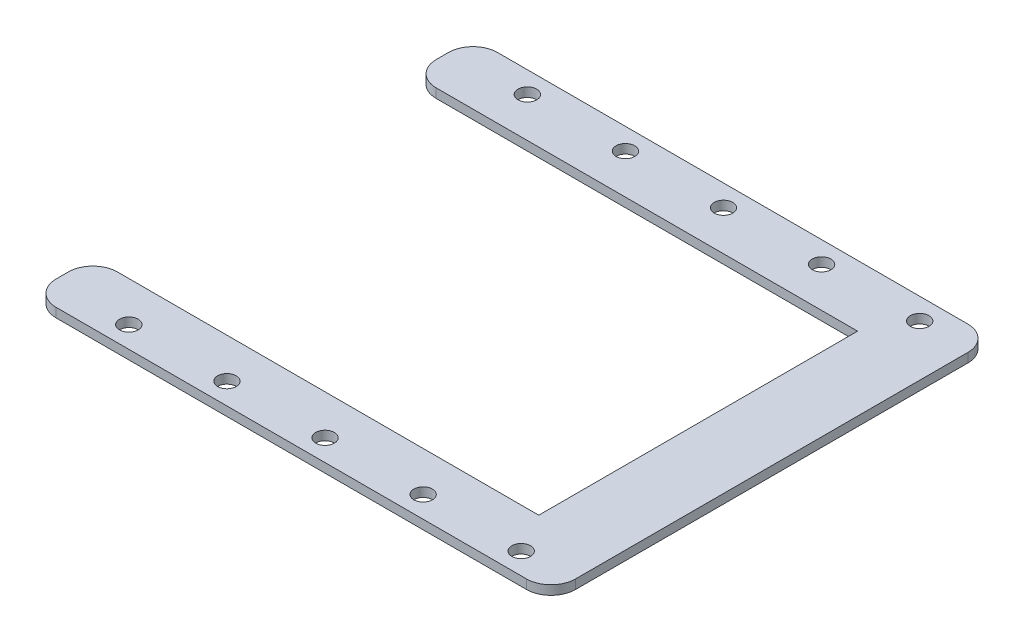
from build123d import *

# Parameters (mm, degrees)
SKETCH1_W          = 153.56078
SKETCH1_H          = 114.3
SKETCH1_R          = 2.413
BASE_FLANGE1_DEPTH = 2.38125
FILLET1_R          = 6.35
SKETCH7_W          = 19.05
SKETCH7_H          = 114.3
CUT_EXTRUDE2_DEPTH = 2.54
FILLET2_R          = 6.35


# Sheet-metal steps are written as plain solids
with BuildPart() as part:
    # Sketch1 → Base-Flange1 (new body)
    with BuildSketch(Plane(origin=(0, 0, 0), x_dir=(1, 0, 0), z_dir=(0, 1, 0))):
        Rectangle(SKETCH1_W, SKETCH1_H)
        with Locations(Location((-63.5, -51.59375, 0), (0, 0, 270))):
            Circle(SKETCH1_R, mode=Mode.SUBTRACT)
        with Locations(Location((-38.1, -51.59375, 0), (0, 0, 270))):
            Circle(SKETCH1_R, mode=Mode.SUBTRACT)
        with Locations(Location((-12.7, -51.59375, 0), (0, 0, 270))):
            Circle(SKETCH1_R, mode=Mode.SUBTRACT)
        with Locations(Location((12.7, -51.59375, 0), (0, 0, 270))):
            Circle(SKETCH1_R, mode=Mode.SUBTRACT)
        with Locations(Location((38.1, -51.59375, 0), (0, 0, 270))):
            Circle(SKETCH1_R, mode=Mode.SUBTRACT)
        with Locations(Location((63.5, -51.59375, 0), (0, 0, 270))):
            Circle(SKETCH1_R, mode=Mode.SUBTRACT)
        with Locations(Location((63.5, 51.59375, 0), (0, 0, 270))):
            Circle(SKETCH1_R, mode=Mode.SUBTRACT)
        with Locations(Location((38.1, 51.59375, 0), (0, 0, 270))):
            Circle(SKETCH1_R, mode=Mode.SUBTRACT)
        with Locations(Location((12.7, 51.59375, 0), (0, 0, 270))):
            Circle(SKETCH1_R, mode=Mode.SUBTRACT)
        with Locations(Location((-12.7, 51.59375, 0), (0, 0, 270))):
            Circle(SKETCH1_R, mode=Mode.SUBTRACT)
        with Locations(Location((-38.1, 51.59375, 0), (0, 0, 270))):
            Circle(SKETCH1_R, mode=Mode.SUBTRACT)
        with Locations(Location((-63.5, 51.59375, 0), (0, 0, 270))):
            Circle(SKETCH1_R, mode=Mode.SUBTRACT)
        Polygon((57.73039, -41.275), (-63.104482091, -41.275), (-63.104482091, 41.275), (21.327886111, 41.275), (57.73039, 41.275), (57.73039, 15.875), align=None, mode=Mode.SUBTRACT)
    extrude(amount=-BASE_FLANGE1_DEPTH)

    # Fillet1
    fillet1_edges = [part.edges().sort_by_distance(p)[0] for p in [
        (-76.78039, -1.190625, -57.15),
        (76.78039, -1.190625, -57.15),
        (76.78039, -1.190625, 57.15),
        (-76.78039, -1.190625, 57.15),
    ]]
    fillet(fillet1_edges, radius=FILLET1_R)

    # Sketch7 → Cut-Extrude2 (cut)
    with BuildSketch(Plane(origin=(0, -2.38125, 0), x_dir=(-1, 0, 0), z_dir=(0, -1, 0))):
        with Locations((67.25539, 0)):
            Rectangle(SKETCH7_W, SKETCH7_H)
    extrude(amount=-CUT_EXTRUDE2_DEPTH, mode=Mode.SUBTRACT)

    # Fillet2
    fillet2_edges = [part.edges().sort_by_distance(p)[0] for p in [
        (-57.73039, -1.190625, 41.275),
        (-57.73039, -1.190625, -41.275),
        (-57.73039, -1.190625, 57.15),
        (-57.73039, -1.190625, -57.15),
    ]]
    fillet(fillet2_edges, radius=FILLET2_R)


solid = part.part
